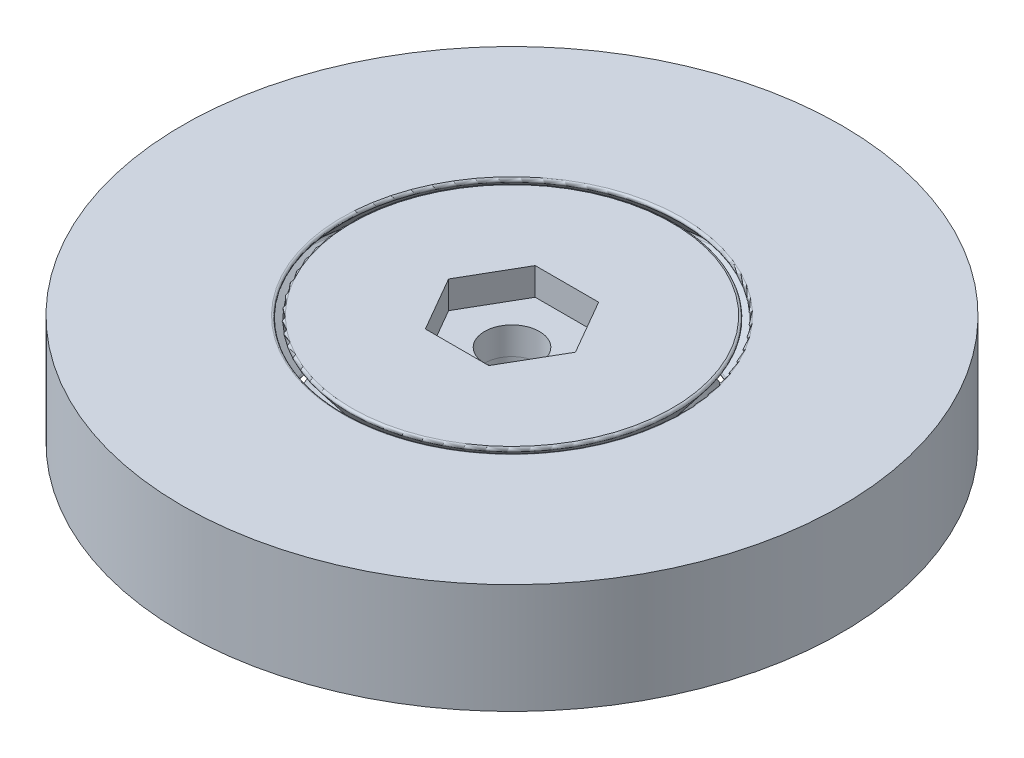
from build123d import *

# Parameters (mm, degrees)
FILLET1_R                = 0.2
CUTEXTRUDE1_DEPTH        = 2.5
F_5_0_5_DIAMETER_HOLE1_D = 5
FILLET2_R                = 0.2
FILLET3_R                = 0.2


# Read off the part's stored shape, not the designer's step: Body2, Body3
with BuildPart() as part:
    # profile → Body1 (revolve)
    with BuildSketch(Plane.XY, mode=Mode.PRIVATE) as body1_sk:
        Polygon((0, 0), (15, 0), (11.16336506, 5), (0, 5), align=None)
    revolve(body1_sk.sketch.rotate(Axis((0, 0, 0), (0, 1, 0)), 90), axis=Axis((0, 0, 0), (0, 1, 0)))

    # Fillet1
    fillet1_edges = [part.edges().sort_by_distance(p)[0] for p in [
        (0, 0, 15),
        (0, 5, 11.16336506),
    ]]
    fillet(fillet1_edges, radius=FILLET1_R)

    # Sketch6 → CutExtrude1 (cut)
    with BuildSketch(Plane(origin=(0, 0, 0), x_dir=(-1, 0, 0), z_dir=(0, -1, 0))):
        Polygon((5.773502692, 0), (2.886751346, 5), (-2.886751346, 5), (-5.773502692, 0), (-2.886751346, -5), (2.886751346, -5), align=None)
    extrude(amount=-CUTEXTRUDE1_DEPTH, mode=Mode.SUBTRACT)

    # Ø5.0 (5) Diameter Hole1 (through all)
    with Locations(Plane(origin=(0, 2.5, 0), x_dir=(-1, 0, 0), z_dir=(0, -1, 0))):
        with Locations((0, 0)):
            Hole(F_5_0_5_DIAMETER_HOLE1_D / 2)


with BuildPart() as body_2:
    # Mirror1: mirrored copy
    add(part.part.mirror(Plane.ZX.offset(5)))


with BuildPart() as body_3:
    # Body2 outline → Body2 (revolve)
    with BuildSketch(Plane.XY):
        Polygon((30, 10), (15, 10), (20, 5), (15, 0), (30, 0), align=None)
    revolve(axis=Axis((0, 0, 0), (0, 1, 0)))

    # Fillet2
    fillet2_edges = [body_3.edges().sort_by_distance(p)[0] for p in [
        (-15, 10, 0),
        (-15, 0, 0),
        (-20, 5, 0),
    ]]
    fillet(fillet2_edges, radius=FILLET2_R)


with BuildPart() as body_4:
    # Body3 outline → Body3 (revolve)
    with BuildSketch(Plane(origin=(6.185580792, -5.424608764, 0), x_dir=(0.7518398074789754, -0.6593458151000714, 0), z_dir=(0, 0, 1))):
        Polygon((0, 16.759624181), (0, 11.285934514), (2.941391129, 11.285934514), (3.300155705, 16.759624181), align=None)
    revolve(axis=Axis((6.185580792, -5.424608764, 0), (0.6593458151000715, 0.7518398074789756, 0)))

    # Fillet3
    fillet3_edges = [body_4.edges().sort_by_distance(p)[0] for p in [
        (11.415459543, 5, 0),
        (14.754780428, 9.351887707, 0),
    ]]
    fillet(fillet3_edges, radius=FILLET3_R)


solid = Compound([part.part, body_2.part, body_3.part, body_4.part])
